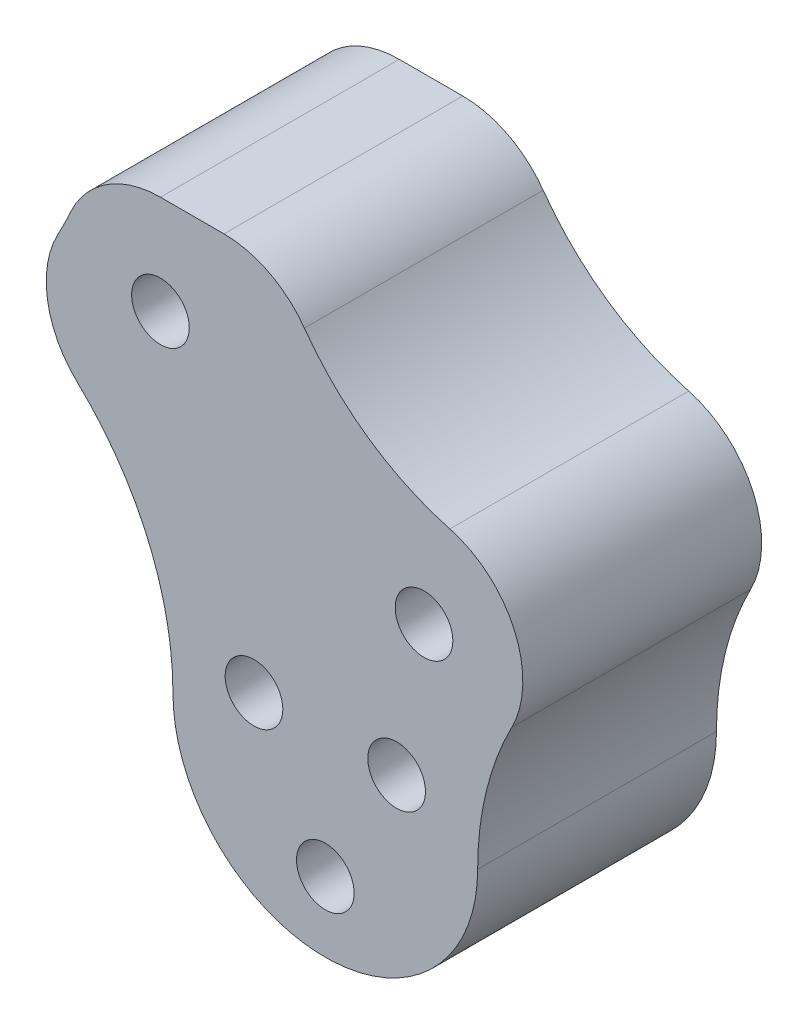
from build123d import *

# Parameters (mm, degrees)
EXTRUDE_2_DEPTH     = 14.5
FILLET_2_R          = 6
CUT_EXTRUDE_1_REACH = 62.084
SKETCH_2_R          = 1.75


with BuildPart() as part:
    # 草图1 → 凸台-拉伸2 (new body)
    with BuildSketch(Plane(origin=(0, 0, 0), x_dir=(-1, 0, 0), z_dir=(0, 0, 1))):
        with BuildLine():
            Line((-37.405308562, 24.446583048), (-45.355478911, 16.778806877))
            ThreePointArc((-45.355478911, 16.778806877), (-31.34055986, 20.996004639), (-19.758509765, 12.048444717))
            Line((-19.758509765, 12.048444717), (-8.309528731, 12.048444717))
            ThreePointArc((-8.309528731, 12.048444717), (-6.330928861, 16.982098954), (-3.353982561, 21.385914608))
            ThreePointArc((-3.353982561, 21.385914608), (-10.582575483, 28.195748099), (-13.248153532, 37.762413217))
            ThreePointArc((-13.248153532, 37.762413217), (-22.498153532, 47.012413217), (-31.748153532, 37.762413217))
            ThreePointArc((-31.748153532, 37.762413217), (-33.221077565, 30.528556429), (-37.405308562, 24.446583048))
        make_face()
    extrude(amount=EXTRUDE_2_DEPTH)

    # 圆角2
    fillet_2_edges = [part.edges().sort_by_distance(p)[0] for p in [
        (19.758509765, -12.048444717, 7.25),
    ]]
    fillet(fillet_2_edges, radius=FILLET_2_R)
    fillet_2_2_edges = [part.edges().sort_by_distance(p)[0] for p in [
        (8.309528731, -12.048444717, 7.25),
    ]]
    fillet(fillet_2_2_edges, radius=FILLET_2_R)
    fillet_2_3_edges = [part.edges().sort_by_distance(p)[0] for p in [
        (3.353982561, -21.385914608, 7.25),
    ]]
    fillet(fillet_2_3_edges, radius=FILLET_2_R)
    fillet_2_4_edges = [part.edges().sort_by_distance(p)[0] for p in [
        (45.355478911, -16.778806877, 7.25),
    ]]
    fillet(fillet_2_4_edges, radius=FILLET_2_R)

    # 草图2 → 切除-拉伸1 (cut, up to next)
    with BuildSketch(Plane.XY.offset(14.5), mode=Mode.PRIVATE) as cut_extrude_1_sk1:
        with Locations((22.498153532, -42.762413217)):
            Circle(SKETCH_2_R)
    cut_extrude_1_tool1 = extrude(cut_extrude_1_sk1.sketch, amount=-CUT_EXTRUDE_1_REACH, mode=Mode.PRIVATE) & part.part
    # 草图2 → 切除-拉伸1 (cut, up to next)
    with BuildSketch(Plane.XY.offset(14.5), mode=Mode.PRIVATE) as cut_extrude_1_sk2:
        with Locations((18.168026513, -35.262413217)):
            Circle(SKETCH_2_R)
    cut_extrude_1_tool2 = extrude(cut_extrude_1_sk2.sketch, amount=-CUT_EXTRUDE_1_REACH, mode=Mode.PRIVATE) & part.part
    # 草图2 → 切除-拉伸1 (cut, up to next)
    with BuildSketch(Plane.XY.offset(14.5), mode=Mode.PRIVATE) as cut_extrude_1_sk3:
        with Locations((26.828280551, -35.262413217)):
            Circle(SKETCH_2_R)
    cut_extrude_1_tool3 = extrude(cut_extrude_1_sk3.sketch, amount=-CUT_EXTRUDE_1_REACH, mode=Mode.PRIVATE) & part.part
    # 草图2 → 切除-拉伸1 (cut, up to next)
    with BuildSketch(Plane.XY.offset(14.5), mode=Mode.PRIVATE) as cut_extrude_1_sk4:
        with Locations((28.492231625, -26.496097848)):
            Circle(SKETCH_2_R)
    cut_extrude_1_tool4 = extrude(cut_extrude_1_sk4.sketch, amount=-CUT_EXTRUDE_1_REACH, mode=Mode.PRIVATE) & part.part
    # 草图2 → 切除-拉伸1 (cut, up to next)
    with BuildSketch(Plane.XY.offset(14.5), mode=Mode.PRIVATE) as cut_extrude_1_sk5:
        with Locations((12.488504069, -18.048444717)):
            Circle(SKETCH_2_R)
    cut_extrude_1_tool5 = extrude(cut_extrude_1_sk5.sketch, amount=-CUT_EXTRUDE_1_REACH, mode=Mode.PRIVATE) & part.part
    add(cut_extrude_1_tool1.solids().sort_by_distance((22.498154, -42.762413, 14.5))[0], mode=Mode.SUBTRACT)
    add(cut_extrude_1_tool2.solids().sort_by_distance((18.168027, -35.262413, 14.5))[0], mode=Mode.SUBTRACT)
    add(cut_extrude_1_tool3.solids().sort_by_distance((26.828281, -35.262413, 14.5))[0], mode=Mode.SUBTRACT)
    add(cut_extrude_1_tool4.solids().sort_by_distance((28.492232, -26.496098, 14.5))[0], mode=Mode.SUBTRACT)
    add(cut_extrude_1_tool5.solids().sort_by_distance((12.488504, -18.048445, 14.5))[0], mode=Mode.SUBTRACT)


solid = part.part
